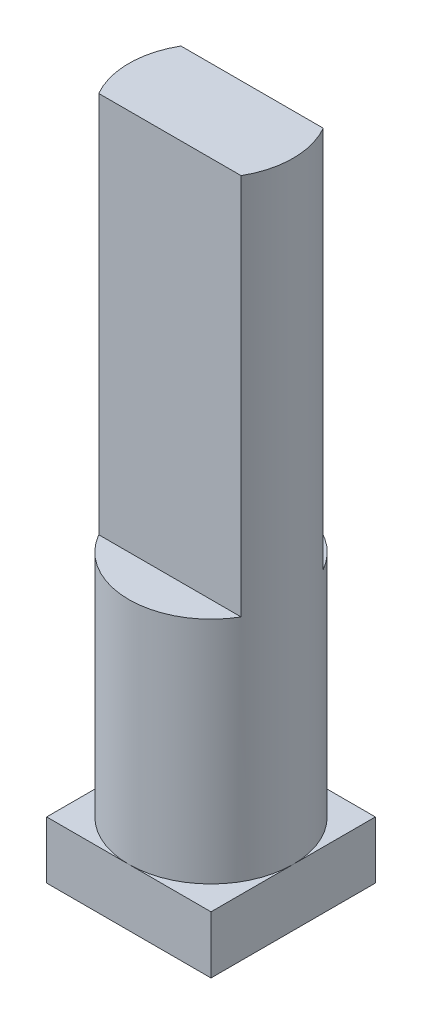
from build123d import *

# Parameters (mm, degrees)
SKETCH1_W           = 8.6
SKETCH1_H           = 8.6
BOSS_EXTRUDE1_DEPTH = 3
SKETCH2_R           = 4.3
BOSS_EXTRUDE2_DEPTH = 32
CUT_EXTRUDE2_START  = -20
CUT_EXTRUDE2_DEPTH  = 20


with BuildPart() as part:
    # Sketch1 → Boss-Extrude1 (new body)
    with BuildSketch(Plane(origin=(0, 0, 0), x_dir=(1, 0, 0), z_dir=(0, 1, 0))):
        Rectangle(SKETCH1_W, SKETCH1_H)
    extrude(amount=BOSS_EXTRUDE1_DEPTH)

    # Sketch2 → Boss-Extrude2 (add)
    with BuildSketch(Plane(origin=(0, 3, 0), x_dir=(1, 0, 0), z_dir=(0, 1, 0))):
        Circle(SKETCH2_R)
    extrude(amount=BOSS_EXTRUDE2_DEPTH)

    # Sketch4 → Cut-Extrude2 (cut)
    with BuildSketch(Plane(origin=(0, 35, 0), x_dir=(1, 0, 0), z_dir=(0, 1, 0)).offset(CUT_EXTRUDE2_START)):
        with BuildLine():
            Line((0, 2.15), (-3.723909236, 2.15))
            ThreePointArc((-3.723909236, 2.15), (0, 4.3), (3.723909236, 2.15))
            Line((3.723909236, 2.15), (0, 2.15))
        make_face()
        with BuildLine():
            Line((0, -2.15), (-3.723909236, -2.15))
            ThreePointArc((-3.723909236, -2.15), (0, -4.3), (3.723909236, -2.15))
            Line((3.723909236, -2.15), (0, -2.15))
        make_face()
    extrude(amount=CUT_EXTRUDE2_DEPTH, mode=Mode.SUBTRACT)


solid = part.part
